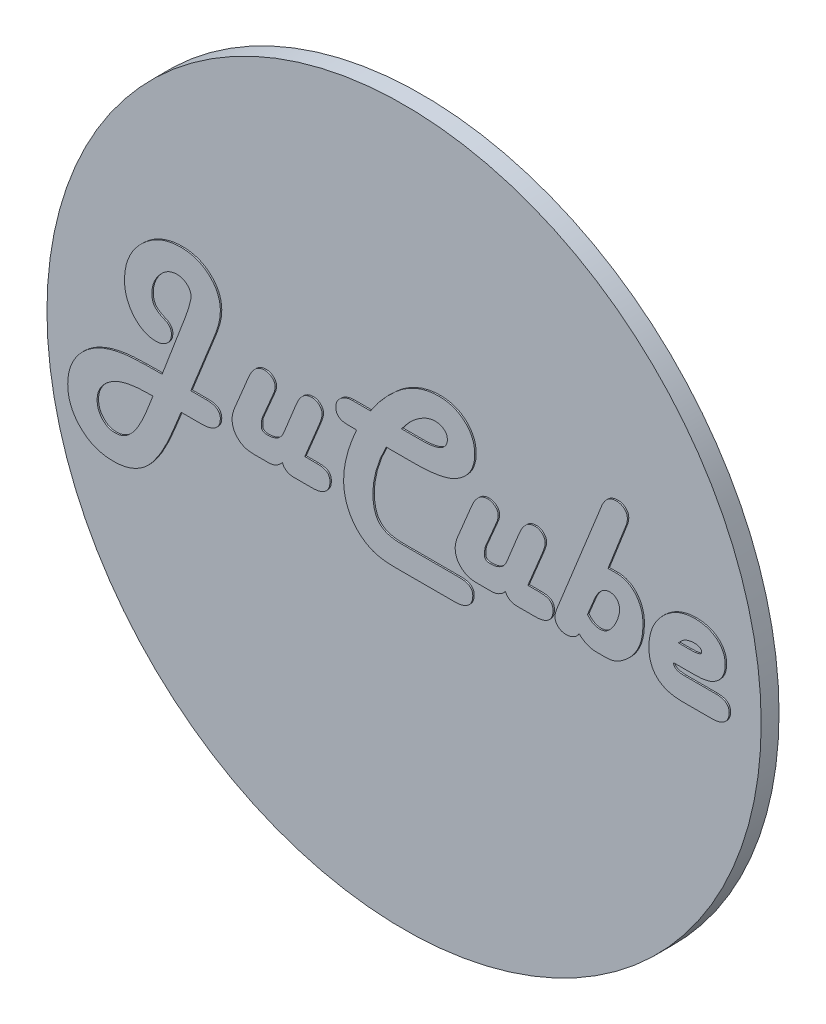
from build123d import *

# Parameters (mm, degrees)
SKETCH2_R           = 63.5
BOSS_EXTRUDE1_DEPTH = 3.175
BOSS_EXTRUDE2_DEPTH = 0.254


with BuildPart() as part:
    # Sketch2 → Boss-Extrude1 (new body)
    with BuildSketch(Plane.XY):
        Circle(SKETCH2_R)
    extrude(amount=BOSS_EXTRUDE1_DEPTH)

    # Sketch3 → Boss-Extrude2 (add)
    # profile 1 of 6: a face of its own
    with BuildSketch(Plane.XY.offset(3.175)):
        with BuildLine():
            Line((-37.659123821, 0.761566628), (-34.929928615, 0.761566628))
            add(Edge.make_bspline(
                [(-34.929928615, 0.761566628), (-34.732000697, 0.757334956), (-34.361404649, 0.749411664), (-33.846895815, 0.666966717), (-33.405729695, 0.542819083), (-33.046187459, 0.349501415), (-32.75569756, 0.108226576), (-32.55494843, -0.198645015), (-32.429839223, -0.557474704), (-32.418629851, -0.815774235), (-32.412762519, -0.950976181)],
                knots=[0, 0, 0, 0, 1.374766829, 2.57408433, 3.614346374, 4.544477883, 5.393131557, 6.21082457, 7.063490371, 8, 8, 8, 8], degree=3))
            add(Edge.make_bspline(
                [(-32.412762519, -0.950976181), (-32.42185546, -1.133653216), (-32.439475455, -1.487638649), (-32.616251317, -1.98773381), (-32.906818969, -2.421872662), (-33.307274661, -2.784915129), (-33.806577268, -3.066016083), (-34.390629542, -3.273847797), (-35.063213752, -3.389069801), (-35.538399919, -3.405247137), (-35.788918341, -3.413775838)],
                knots=[0, 0, 0, 0, 0.929567561, 1.801284846, 2.668377082, 3.571806983, 4.533225673, 5.574775137, 6.721420051, 8, 8, 8, 8], degree=3))
            Line((-35.788918341, -3.413775838), (-39.38797656, -3.413775838))
            Line((-39.38797656, -3.413775838), (-40.758010807, -6.78993166))
            add(Edge.make_bspline(
                [(-40.758010807, -6.78993166), (-40.94094851, -7.24095224), (-41.294886851, -8.113563373), (-41.869771364, -9.355300485), (-42.444799767, -10.495661457), (-43.016801144, -11.541187209), (-43.610746434, -12.474231369), (-44.203680932, -13.310722851), (-44.797157232, -14.050084639), (-45.414039488, -14.681322226), (-46.047165869, -15.232128734), (-46.718304588, -15.697839826), (-47.421880148, -16.100513336), (-48.169538921, -16.420424934), (-48.950929595, -16.677623268), (-49.772431327, -16.856998146), (-50.630135408, -16.959859916), (-51.214213211, -16.975614711), (-51.511692314, -16.983638852)],
                knots=[0, 0, 0, 0, 1.468908974, 2.841968597, 4.1287121, 5.323593136, 6.437448851, 7.465024802, 8.417576394, 9.295662056, 10.125698866, 10.94665604, 11.757436234, 12.568345582, 13.39692117, 14.237044157, 15.102101602, 16, 16, 16, 16], degree=3))
            add(Edge.make_bspline(
                [(-51.511692314, -16.983638852), (-51.79300825, -16.978714749), (-52.345174208, -16.969049735), (-53.154106481, -16.853131777), (-53.928944651, -16.683452373), (-54.668070179, -16.435918773), (-55.372159073, -16.120931999), (-56.039539903, -15.730779636), (-56.67240655, -15.273070202), (-57.261460462, -14.747471473), (-57.796234402, -14.169862414), (-58.266123003, -13.552860262), (-58.668826651, -12.903400132), (-58.986814375, -12.212637489), (-59.246634448, -11.493794487), (-59.425865919, -10.73702721), (-59.528555794, -9.946030557), (-59.544423415, -9.407067287), (-59.552488547, -9.133125153)],
                knots=[0, 0, 0, 0, 1.074409005, 2.108846326, 3.117072076, 4.102727955, 5.08240308, 6.060117382, 7.05212911, 8.062778769, 9.072478569, 10.056063612, 11.023046353, 11.986724094, 12.957247774, 13.940052078, 14.952977764, 16, 16, 16, 16], degree=3))
            add(Edge.make_bspline(
                [(-59.552488547, -9.133125153), (-59.548557226, -8.924522998), (-59.540777556, -8.511721197), (-59.47110314, -7.900011899), (-59.370206804, -7.299917087), (-59.2222682, -6.711237158), (-59.03176017, -6.133297959), (-58.797185315, -5.569163223), (-58.524541113, -5.016100147), (-58.208277655, -4.4796688), (-57.857476424, -3.957803765), (-57.463078214, -3.461419005), (-57.032657956, -2.989230409), (-56.571103829, -2.537527223), (-56.074827024, -2.110707886), (-55.539272776, -1.716170474), (-54.973299911, -1.337080429), (-54.574019145, -1.109815875), (-54.371366971, -0.994469331)],
                knots=[0, 0, 0, 0, 0.986633776, 1.952444828, 2.909577263, 3.864094578, 4.821227013, 5.786162288, 6.752467993, 7.73626618, 8.730323382, 9.725267674, 10.732877573, 11.751517376, 12.779174888, 13.826952509, 14.897084866, 16, 16, 16, 16], degree=3))
            add(Edge.make_bspline(
                [(-54.371366971, -0.994469331), (-54.098172271, -0.85535278), (-53.538982224, -0.570601315), (-52.633366723, -0.228852468), (-51.659879349, 0.074069721), (-50.607504328, 0.30607127), (-49.485249233, 0.50073947), (-48.286298376, 0.624098713), (-47.013209798, 0.709671837), (-46.138632965, 0.71881168), (-45.689046766, 0.723510121)],
                knots=[0, 0, 0, 0, 0.822641494, 1.683828184, 2.595046862, 3.558297765, 4.575076227, 5.651965759, 6.792966211, 8, 8, 8, 8], degree=3))
            Line((-45.689046766, 0.723510121), (-42.764132382, 0.761566628))
            Line((-42.764132382, 0.761566628), (-38.681212862, 11.498938203))
            add(Edge.make_bspline(
                [(-38.681212862, 11.498938203), (-38.598756739, 11.723333537), (-38.441578026, 12.151078242), (-38.230742664, 12.768315854), (-38.041899513, 13.326004628), (-37.895868336, 13.832723373), (-37.780641924, 14.282258613), (-37.697760768, 14.67557985), (-37.643957976, 15.013162142), (-37.635692743, 15.221076126), (-37.631940601, 15.315462175)],
                knots=[0, 0, 0, 0, 1.444318592, 2.753175028, 3.940779609, 5.001085105, 5.938491443, 6.743748221, 7.429703383, 8, 8, 8, 8], degree=3))
            add(Edge.make_bspline(
                [(-37.631940601, 15.315462175), (-37.639061892, 15.45638358), (-37.65322501, 15.736653912), (-37.807150594, 16.136068021), (-38.038192881, 16.508539132), (-38.362768598, 16.834041558), (-38.73995381, 17.114611654), (-39.16764032, 17.31984482), (-39.631144023, 17.443435823), (-39.95262529, 17.456352671), (-40.116486834, 17.462936491)],
                knots=[0, 0, 0, 0, 0.926502715, 1.842667016, 2.789054029, 3.8047205, 4.857979717, 5.880393009, 6.919619551, 8, 8, 8, 8], degree=3))
            add(Edge.make_bspline(
                [(-40.116486834, 17.462936491), (-40.256386136, 17.457439369), (-40.534613385, 17.44650687), (-40.946931004, 17.366410861), (-41.350246588, 17.241597811), (-41.745321775, 17.066258696), (-42.128468099, 16.835804412), (-42.495975681, 16.548195864), (-42.864391924, 16.222560887), (-43.211295225, 15.845319681), (-43.530637762, 15.438564698), (-43.820177326, 15.019493951), (-44.049500327, 14.581571233), (-44.250893892, 14.139125425), (-44.402094466, 13.681358278), (-44.510381764, 13.213674485), (-44.578911039, 12.735077402), (-44.586833199, 12.412524734), (-44.590844711, 12.249195052)],
                knots=[0, 0, 0, 0, 0.890503997, 1.771005816, 2.665315563, 3.574615816, 4.516720043, 5.504645526, 6.542601364, 7.645023422, 8.762504704, 9.834794883, 10.882965811, 11.905928596, 12.927784102, 13.946768121, 14.960313327, 16, 16, 16, 16], degree=3))
            add(Edge.make_bspline(
                [(-44.590844711, 12.249195052), (-44.58462232, 12.080249628), (-44.572677658, 11.755937689), (-44.481626816, 11.296391877), (-44.326893813, 10.890538116), (-44.112382085, 10.527047415), (-43.800760714, 10.21748581), (-43.414353194, 9.928166457), (-42.939059556, 9.657183009), (-42.582920228, 9.507038097), (-42.394440601, 9.427576901)],
                knots=[0, 0, 0, 0, 1.048922844, 2.013539002, 2.893545401, 3.737095429, 4.612700145, 5.600929284, 6.730339736, 8, 8, 8, 8], degree=3))
            add(Edge.make_bspline(
                [(-42.394440601, 9.427576901), (-42.293523138, 9.382890746), (-42.098708391, 9.296626964), (-41.835779784, 9.131728034), (-41.611140187, 8.948308597), (-41.429682502, 8.743523317), (-41.281275578, 8.523022086), (-41.186996436, 8.275294676), (-41.124177662, 8.011713598), (-41.115708098, 7.829581334), (-41.111392656, 7.736780669)],
                knots=[0, 0, 0, 0, 1.167516901, 2.25381717, 3.276011108, 4.227479954, 5.143046177, 6.073179368, 7.018239636, 8, 8, 8, 8], degree=3))
            add(Edge.make_bspline(
                [(-41.111392656, 7.736780669), (-41.120557067, 7.569052784), (-41.138563291, 7.239501236), (-41.288608462, 6.766075357), (-41.550450915, 6.345763692), (-41.88976163, 5.970131542), (-42.309936774, 5.670460098), (-42.779841794, 5.439085007), (-43.304520572, 5.308699137), (-43.669552917, 5.292941541), (-43.856897793, 5.284854299)],
                knots=[0, 0, 0, 0, 0.979783024, 1.925076521, 2.866678614, 3.857011038, 4.866165817, 5.866431161, 6.904992405, 8, 8, 8, 8], degree=3))
            add(Edge.make_bspline(
                [(-43.856897793, 5.284854299), (-44.047484016, 5.291897574), (-44.423379813, 5.305789123), (-44.976962026, 5.392893029), (-45.509000964, 5.545156757), (-46.016130847, 5.768400552), (-46.508026459, 6.037449282), (-46.97460369, 6.376016848), (-47.420093542, 6.772050462), (-47.834507718, 7.229188406), (-48.216523508, 7.722260447), (-48.554017623, 8.247919439), (-48.826828784, 8.805729123), (-49.064366477, 9.381261758), (-49.245632105, 9.985677316), (-49.366995947, 10.616134606), (-49.446193159, 11.272229654), (-49.456721611, 11.717982197), (-49.462077588, 11.944742997)],
                knots=[0, 0, 0, 0, 0.946241094, 1.866284174, 2.774639195, 3.685486034, 4.61179857, 5.553107829, 6.54086954, 7.566109643, 8.611676729, 9.635020141, 10.661049498, 11.690229817, 12.72349202, 13.78747785, 14.874457807, 16, 16, 16, 16], degree=3))
            add(Edge.make_bspline(
                [(-49.462077588, 11.944742997), (-49.452587427, 12.276911868), (-49.433830958, 12.933414513), (-49.287109542, 13.900283343), (-49.056236528, 14.836500593), (-48.718238204, 15.735098271), (-48.303231371, 16.608152048), (-47.770667662, 17.434148158), (-47.161909593, 18.239085414), (-46.460942683, 18.996553097), (-45.694871557, 19.687923497), (-44.898152047, 20.312808211), (-44.052965895, 20.819851549), (-43.186129785, 21.253809479), (-42.276946979, 21.575705222), (-41.341485028, 21.820400483), (-40.368708145, 21.955830949), (-39.710938259, 21.975991943), (-39.377103273, 21.986224162)],
                knots=[0, 0, 0, 0, 1.011155103, 1.998459391, 2.971548179, 3.942380816, 4.917345741, 5.909496761, 6.929394283, 7.987804135, 9.046559243, 10.069810793, 11.065516384, 12.042899322, 13.017020432, 13.996815416, 14.983332755, 16, 16, 16, 16], degree=3))
            add(Edge.make_bspline(
                [(-39.377103273, 21.986224162), (-39.134000327, 21.981596116), (-38.655236172, 21.972481696), (-37.954886639, 21.883117548), (-37.284303269, 21.740036106), (-36.642953579, 21.54870973), (-36.03514958, 21.28809828), (-35.457302259, 20.978697391), (-34.909394183, 20.612802278), (-34.40209964, 20.18908062), (-33.937468484, 19.725591076), (-33.526673797, 19.230483202), (-33.181447142, 18.705634418), (-32.901630164, 18.150705375), (-32.684567981, 17.566868097), (-32.525484661, 16.955227434), (-32.431984314, 16.313246959), (-32.419256223, 15.875742885), (-32.412762519, 15.652534093)],
                knots=[0, 0, 0, 0, 1.10911317, 2.184274766, 3.216023009, 4.236436679, 5.233451808, 6.228921843, 7.224529316, 8.234836295, 9.240800183, 10.216171666, 11.165921024, 12.10177449, 13.046612937, 14.003538441, 14.981431716, 16, 16, 16, 16], degree=3))
            add(Edge.make_bspline(
                [(-32.412762519, 15.652534093), (-32.425495868, 15.349140537), (-32.452302054, 14.710437853), (-32.646754358, 13.712877307), (-32.953221742, 12.630854172), (-33.229852759, 11.892116925), (-33.375048478, 11.504374847)],
                knots=[0, 0, 0, 0, 0.850166335, 1.789766162, 2.839911396, 4, 4, 4, 4], degree=3))
            Line((-33.375048478, 11.504374847), (-37.659123821, 0.761566628))
        make_face()
        with BuildLine():
            add(Edge.make_bspline(
                [(-44.395125533, -3.413775838), (-44.705074548, -3.415003178), (-45.305291902, -3.417379925), (-46.176992632, -3.460045186), (-46.993365688, -3.509813747), (-47.755469849, -3.590222225), (-48.460148251, -3.700960011), (-49.111041158, -3.822360629), (-49.705036818, -3.973094901), (-50.077095438, -4.09840074), (-50.255827588, -4.158596044)],
                knots=[0, 0, 0, 0, 1.253277197, 2.426975682, 3.528706619, 4.560583597, 5.524511111, 6.412754989, 7.237508024, 8, 8, 8, 8], degree=3))
            add(Edge.make_bspline(
                [(-50.255827588, -4.158596044), (-50.558633441, -4.27737887), (-51.14685462, -4.508122674), (-51.944648442, -4.97939686), (-52.650479214, -5.513057415), (-53.24866713, -6.120430548), (-53.730586186, -6.782596729), (-54.082514748, -7.488317528), (-54.289989603, -8.233505129), (-54.318848794, -8.742264106), (-54.333310464, -8.997209057)],
                knots=[0, 0, 0, 0, 1.156315915, 2.246223131, 3.286242349, 4.299011665, 5.269472516, 6.189856709, 7.092916461, 8, 8, 8, 8], degree=3))
            add(Edge.make_bspline(
                [(-54.333310464, -8.997209057), (-54.322141361, -9.230341707), (-54.30034302, -9.685338377), (-54.119867612, -10.338875048), (-53.827246354, -10.936765406), (-53.426355094, -11.466056406), (-52.941205018, -11.907230569), (-52.389742586, -12.229237185), (-51.783419024, -12.423088576), (-51.362687572, -12.447739515), (-51.147437177, -12.460351181)],
                knots=[0, 0, 0, 0, 1.06797539, 2.084329447, 3.084404886, 4.105236595, 5.111786419, 6.072782716, 7.01401647, 8, 8, 8, 8], degree=3))
            add(Edge.make_bspline(
                [(-51.147437177, -12.460351181), (-51.007589047, -12.456641007), (-50.729680248, -12.449268081), (-50.318942175, -12.375442306), (-49.919038893, -12.255841829), (-49.532239371, -12.084338655), (-49.15382751, -11.87164496), (-48.788243334, -11.608185192), (-48.435872758, -11.296212865), (-48.089421437, -10.939078439), (-47.751402392, -10.526900427), (-47.416216742, -10.058625109), (-47.079933018, -9.535430332), (-46.741125795, -8.958543339), (-46.411262934, -8.319787469), (-46.081682699, -7.624397943), (-45.747139206, -6.873896427), (-45.540220694, -6.34859803), (-45.433524505, -6.077731318)],
                knots=[0, 0, 0, 0, 0.738169037, 1.466903219, 2.196831274, 2.938530611, 3.6973333, 4.486394525, 5.314063054, 6.180681392, 7.112286698, 8.127279707, 9.221365764, 10.39702258, 11.660243416, 13.017718709, 14.462205991, 16, 16, 16, 16], degree=3))
            Line((-45.433524505, -6.077731318), (-44.395125533, -3.413775838))
        make_face(mode=Mode.SUBTRACT)
    # profile 2 of 6: a face of its own
    with BuildSketch(Plane.XY.offset(3.175)):
        with BuildLine():
            Line((-17.402188889, 0.761566628), (-15.276461149, 0.761566628))
            add(Edge.make_bspline(
                [(-15.276461149, 0.761566628), (-15.078578303, 0.759287218), (-14.711865945, 0.755063063), (-14.210098024, 0.678471534), (-13.794956786, 0.56519082), (-13.465404173, 0.390089382), (-13.218658697, 0.149192289), (-13.044991842, -0.152789123), (-12.94229572, -0.518608252), (-12.932837387, -0.783554627), (-12.927831012, -0.923792962)],
                knots=[0, 0, 0, 0, 1.423474627, 2.637953448, 3.6454745, 4.509973129, 5.294422611, 6.095734663, 6.992056419, 8, 8, 8, 8], degree=3))
            add(Edge.make_bspline(
                [(-12.927831012, -0.923792962), (-12.935221105, -1.109987413), (-12.949435509, -1.468121329), (-13.114997405, -1.969958778), (-13.376900736, -2.408404023), (-13.742732008, -2.776765929), (-14.20278672, -3.065743584), (-14.747055486, -3.273981391), (-15.373204983, -3.388649654), (-15.816040525, -3.405127417), (-16.048464574, -3.413775838)],
                knots=[0, 0, 0, 0, 0.986942706, 1.898325388, 2.776060673, 3.682537368, 4.631717883, 5.644811449, 6.76386964, 8, 8, 8, 8], degree=3))
            Line((-16.048464574, -3.413775838), (-19.332197451, -3.413775838))
            add(Edge.make_bspline(
                [(-19.332197451, -3.413775838), (-19.455599112, -3.408919917), (-19.692771483, -3.399587057), (-20.033757818, -3.347628606), (-20.342914078, -3.250175465), (-20.616126042, -3.10638804), (-20.860154508, -2.929348914), (-21.076613243, -2.716848765), (-21.250632979, -2.454977429), (-21.340809122, -2.262481165), (-21.387248821, -2.163347756)],
                knots=[0, 0, 0, 0, 1.152361497, 2.214786302, 3.209888758, 4.163277449, 5.083675317, 6.016734849, 6.978640777, 8, 8, 8, 8], degree=3))
            add(Edge.make_bspline(
                [(-21.387248821, -2.163347756), (-21.472587497, -2.262694357), (-21.638980275, -2.456399692), (-21.911728134, -2.716719326), (-22.208081153, -2.929265375), (-22.519938645, -3.101747599), (-22.842832813, -3.249043311), (-23.185761806, -3.344901419), (-23.545665038, -3.399401489), (-23.790056511, -3.408905678), (-23.915288204, -3.413775838)],
                knots=[0, 0, 0, 0, 1.074888274, 2.095809936, 3.086807958, 4.059318953, 5.018538645, 5.993322927, 6.971733483, 8, 8, 8, 8], degree=3))
            Line((-23.915288204, -3.413775838), (-26.595553615, -3.413775838))
            add(Edge.make_bspline(
                [(-26.595553615, -3.413775838), (-26.854136996, -3.40373138), (-27.354927273, -3.384278594), (-28.068965822, -3.192492526), (-28.714734722, -2.883683873), (-29.278811693, -2.454373797), (-29.741191577, -1.928805376), (-30.082735254, -1.3267446), (-30.291503261, -0.656414877), (-30.313723352, -0.185910159), (-30.325091286, 0.054802929)],
                knots=[0, 0, 0, 0, 1.087915245, 2.106931136, 3.090844651, 4.088450258, 5.073608295, 6.02105831, 6.987561346, 8, 8, 8, 8], degree=3))
            add(Edge.make_bspline(
                [(-30.325091286, 0.054802929), (-30.320183157, 0.203868212), (-30.309861657, 0.517343551), (-30.207044792, 1.000354574), (-30.062153222, 1.52135069), (-29.92435149, 1.871767473), (-29.852103273, 2.05548786)],
                knots=[0, 0, 0, 0, 0.863914828, 1.816760999, 2.8553473, 4, 4, 4, 4], degree=3))
            Line((-29.852103273, 2.05548786), (-27.378430327, 8.019486148))
            add(Edge.make_bspline(
                [(-27.378430327, 8.019486148), (-27.291343221, 8.215130561), (-27.12495941, 8.588917962), (-26.831696188, 9.096498409), (-26.514209176, 9.530686056), (-26.167619107, 9.883164517), (-25.79916583, 10.166399162), (-25.399603916, 10.355176183), (-24.979886333, 10.48522119), (-24.688285534, 10.497705389), (-24.540502245, 10.504032381)],
                knots=[0, 0, 0, 0, 1.280028315, 2.445551341, 3.499011175, 4.487645763, 5.393702846, 6.261350057, 7.118852184, 8, 8, 8, 8], degree=3))
            add(Edge.make_bspline(
                [(-24.540502245, 10.504032381), (-24.414712081, 10.500316255), (-24.170273167, 10.493094976), (-23.822002511, 10.393072152), (-23.498034297, 10.247385068), (-23.216416608, 10.034735634), (-22.974919214, 9.787854991), (-22.795924864, 9.505764685), (-22.686661485, 9.192475462), (-22.675816478, 8.973577172), (-22.670296766, 8.862165943)],
                knots=[0, 0, 0, 0, 1.088377808, 2.114965752, 3.121466735, 4.15669776, 5.158144943, 6.10535726, 7.035696088, 8, 8, 8, 8], degree=3))
            add(Edge.make_bspline(
                [(-22.670296766, 8.862165943), (-22.673389943, 8.77312266), (-22.67988147, 8.586251078), (-22.738962214, 8.296593203), (-22.831453357, 7.987869131), (-22.915034983, 7.779662543), (-22.958438889, 7.671540943)],
                knots=[0, 0, 0, 0, 0.865948269, 1.817331053, 2.86654086, 4, 4, 4, 4], degree=3))
            Line((-22.958438889, 7.671540943), (-23.154158067, 7.209426217))
            Line((-23.154158067, 7.209426217), (-25.035236834, 2.773124847))
            Line((-25.035236834, 2.773124847), (-25.073293341, 2.245770395))
            add(Edge.make_bspline(
                [(-25.073293341, 2.245770395), (-25.081178842, 2.11169573), (-25.094707848, 1.88166635), (-25.102614863, 1.651378967), (-25.105913204, 1.555316628)],
                knots=[0, 0, 0, 0, 1.165717742, 2, 2, 2, 2], degree=3))
            add(Edge.make_bspline(
                [(-25.105913204, 1.555316628), (-25.107194276, 1.493390257), (-25.109644699, 1.374937988), (-25.064268859, 1.209238698), (-24.987670306, 1.06541288), (-24.866391769, 0.955305125), (-24.716159452, 0.867846174), (-24.534064094, 0.802716092), (-24.317305095, 0.765289511), (-24.161908737, 0.76286808), (-24.078387519, 0.761566628)],
                knots=[0, 0, 0, 0, 0.989944688, 1.893558305, 2.727461867, 3.571461481, 4.484864337, 5.506805255, 6.659977222, 8, 8, 8, 8], degree=3))
            add(Edge.make_bspline(
                [(-24.078387519, 0.761566628), (-23.902305477, 0.766534326), (-23.562602324, 0.776118169), (-23.075210855, 0.856228085), (-22.635458897, 0.99782624), (-22.242624404, 1.195851496), (-21.895415476, 1.449224083), (-21.593282578, 1.75684915), (-21.337569223, 2.122678164), (-21.212571269, 2.397475143), (-21.148036492, 2.539349162)],
                knots=[0, 0, 0, 0, 1.152998018, 2.224400943, 3.222961798, 4.167941497, 5.093941346, 6.025705995, 6.980698316, 8, 8, 8, 8], degree=3))
            Line((-21.148036492, 2.539349162), (-18.929885807, 8.014049504))
            add(Edge.make_bspline(
                [(-18.929885807, 8.014049504), (-18.84621791, 8.209482286), (-18.686532185, 8.582478697), (-18.404783727, 9.094823181), (-18.088286848, 9.526086488), (-17.751813855, 9.884488135), (-17.387631718, 10.167554912), (-16.98904609, 10.355037708), (-16.569416246, 10.485256749), (-16.27780355, 10.497717349), (-16.130014232, 10.504032381)],
                knots=[0, 0, 0, 0, 1.276554646, 2.436389105, 3.503204744, 4.481005901, 5.382319852, 6.253756509, 7.115003774, 8, 8, 8, 8], degree=3))
            add(Edge.make_bspline(
                [(-16.130014232, 10.504032381), (-16.009779936, 10.497700741), (-15.77465904, 10.485319077), (-15.434273271, 10.389013064), (-15.121946532, 10.230411583), (-14.846267094, 10.011294266), (-14.614385056, 9.755099803), (-14.43877245, 9.467192927), (-14.337414623, 9.147847423), (-14.325627056, 8.926294898), (-14.319611834, 8.813236148)],
                knots=[0, 0, 0, 0, 1.048999871, 2.051343087, 3.063635363, 4.089572167, 5.109631033, 6.067886396, 7.014038103, 8, 8, 8, 8], degree=3))
            add(Edge.make_bspline(
                [(-14.319611834, 8.813236148), (-14.325848123, 8.707739888), (-14.339985554, 8.468583853), (-14.436658831, 8.07782782), (-14.585909584, 7.612103966), (-14.71614142, 7.281168578), (-14.787163204, 7.10069334)],
                knots=[0, 0, 0, 0, 0.709652047, 1.608754381, 2.695936919, 4, 4, 4, 4], degree=3))
            Line((-14.787163204, 7.10069334), (-17.402188889, 0.761566628))
        make_face()
    # profile 3 of 6: a face of its own
    with BuildSketch(Plane.XY.offset(3.175)):
        with BuildLine():
            add(Edge.make_bspline(
                [(-2.924406355, 9.460196764), (-3.110888384, 9.086710906), (-3.476506858, 8.354450914), (-3.955560957, 7.250065392), (-4.359505456, 6.16460287), (-4.692647162, 5.101744473), (-4.949658865, 4.057524819), (-5.13678633, 3.033992717), (-5.248494977, 2.028980833), (-5.264944955, 1.365294447), (-5.273036492, 1.038835463)],
                knots=[0, 0, 0, 0, 1.135220372, 2.225724058, 3.27216563, 4.283906486, 5.253382005, 6.19501987, 7.112152981, 8, 8, 8, 8], degree=3))
            add(Edge.make_bspline(
                [(-5.273036492, 1.038835463), (-5.271136197, 0.817577207), (-5.267452508, 0.388671957), (-5.204503622, -0.228553641), (-5.114285604, -0.799539831), (-4.987251381, -1.321395079), (-4.814644625, -1.792667656), (-4.619882919, -2.221944793), (-4.368223515, -2.592898803), (-4.092388005, -2.92683126), (-3.76060235, -3.208424107), (-3.38685358, -3.452882751), (-2.959265794, -3.654447302), (-2.487515364, -3.821322226), (-1.965185908, -3.952756363), (-1.39356115, -4.040305822), (-0.772933043, -4.104437526), (-0.342184724, -4.107882224), (-0.119098136, -4.109666249)],
                knots=[0, 0, 0, 0, 1.252459074, 2.42786996, 3.509382925, 4.524948922, 5.463153721, 6.349162468, 7.186018239, 7.994189337, 8.794568284, 9.640001636, 10.516748818, 11.46461486, 12.470227408, 13.561870161, 14.737281046, 16, 16, 16, 16], degree=3))
            Line((-0.119098136, -4.109666249), (10.085482344, -4.109666249))
            add(Edge.make_bspline(
                [(10.085482344, -4.109666249), (10.27247775, -4.114438186), (10.622846194, -4.123379241), (11.112189896, -4.199732072), (11.530644038, -4.317683534), (11.875246982, -4.500226608), (12.14338358, -4.739413007), (12.341867466, -5.028728981), (12.452020157, -5.376200233), (12.465220618, -5.622098446), (12.472168988, -5.751532688)],
                knots=[0, 0, 0, 0, 1.364402225, 2.556445067, 3.607043229, 4.52467117, 5.377329535, 6.206674295, 7.056041324, 8, 8, 8, 8], degree=3))
            add(Edge.make_bspline(
                [(12.472168988, -5.751532688), (12.46252124, -5.94126782), (12.444054089, -6.304447648), (12.280079466, -6.817568915), (12.007529634, -7.26483141), (11.623475233, -7.6364588), (11.146756495, -7.935758573), (10.576621138, -8.136246746), (9.926125438, -8.262913528), (9.464554983, -8.27737804), (9.221055974, -8.285008715)],
                knots=[0, 0, 0, 0, 0.975907244, 1.868024237, 2.744304013, 3.649190112, 4.597713907, 5.623187205, 6.746125208, 8, 8, 8, 8], degree=3))
            Line((9.221055974, -8.285008715), (-1.418456012, -8.285008715))
            add(Edge.make_bspline(
                [(-1.418456012, -8.285008715), (-1.636003908, -8.283716044), (-2.060582799, -8.281193194), (-2.680391743, -8.238519379), (-3.268677726, -8.188364892), (-3.822820204, -8.108508382), (-4.341871445, -7.995206227), (-4.830753767, -7.875832175), (-5.284593739, -7.722791989), (-5.569179565, -7.600048669), (-5.707967999, -7.540188509)],
                knots=[0, 0, 0, 0, 1.190131533, 2.322728638, 3.398279404, 4.420629422, 5.383336324, 6.304493289, 7.173125649, 8, 8, 8, 8], degree=3))
            add(Edge.make_bspline(
                [(-5.707967999, -7.540188509), (-5.890673412, -7.450535051), (-6.252304324, -7.273082938), (-6.766310714, -6.959470252), (-7.252176256, -6.61120221), (-7.705902291, -6.224989468), (-8.135105783, -5.810918503), (-8.527145658, -5.355925722), (-8.890406948, -4.865933829), (-9.227302686, -4.346334253), (-9.5274127, -3.798272314), (-9.778553936, -3.224273952), (-10.008843038, -2.638266699), (-10.1757898, -2.025805205), (-10.322208765, -1.401356909), (-10.417091309, -0.7557267), (-10.479145647, -0.091391231), (-10.487816767, 0.359109644), (-10.492214574, 0.587594025)],
                knots=[0, 0, 0, 0, 0.978821428, 1.937392436, 2.893262791, 3.852309596, 4.801915283, 5.760010259, 6.738365507, 7.734854603, 8.737656672, 9.740761978, 10.748065266, 11.763749894, 12.791822966, 13.832648446, 14.900765778, 16, 16, 16, 16], degree=3))
            add(Edge.make_bspline(
                [(-10.492214574, 0.587594025), (-10.48363573, 0.904967936), (-10.46604485, 1.555741661), (-10.359011649, 2.554944788), (-10.179155014, 3.599050291), (-9.918020648, 4.685786687), (-9.599688951, 5.819696127), (-9.196937671, 6.994554692), (-8.732004153, 8.218040744), (-8.375300766, 9.039337384), (-8.192514232, 9.460196764)],
                knots=[0, 0, 0, 0, 0.825338176, 1.692352082, 2.610409369, 3.578574102, 4.597433625, 5.671882489, 6.806996102, 8, 8, 8, 8], degree=3))
            Line((-8.192514232, 9.460196764), (-9.220039916, 9.460196764))
            Line((-9.220039916, 9.460196764), (-9.698464574, 9.460196764))
            add(Edge.make_bspline(
                [(-9.698464574, 9.460196764), (-9.869109387, 9.465297169), (-10.19055539, 9.474904872), (-10.639976897, 9.548003234), (-11.023759339, 9.675490137), (-11.336962614, 9.864015828), (-11.586218951, 10.103795428), (-11.764275315, 10.401285901), (-11.868912077, 10.752737596), (-11.878813496, 11.003465046), (-11.883995396, 11.134683066)],
                knots=[0, 0, 0, 0, 1.304291175, 2.456911397, 3.46914742, 4.376890703, 5.229335235, 6.087167935, 6.998920798, 8, 8, 8, 8], degree=3))
            add(Edge.make_bspline(
                [(-11.883995396, 11.134683066), (-11.8748013, 11.304910985), (-11.856713847, 11.639798654), (-11.673665644, 12.11376547), (-11.397889385, 12.549982887), (-11.005557942, 12.92349703), (-10.545526371, 13.243597156), (-10.020867736, 13.472559664), (-9.450386702, 13.614079989), (-9.05416978, 13.628249936), (-8.850348136, 13.63553923)],
                knots=[0, 0, 0, 0, 0.93209166, 1.833694528, 2.756955055, 3.750515861, 4.789799231, 5.824869921, 6.881071041, 8, 8, 8, 8], degree=3))
            Line((-8.850348136, 13.63553923), (-8.355613547, 13.63553923))
            Line((-8.355613547, 13.63553923), (-5.697094711, 13.63553923))
            add(Edge.make_bspline(
                [(-5.697094711, 13.63553923), (-5.403785954, 14.086735299), (-4.804549838, 15.008538601), (-3.742901028, 16.316556166), (-2.559206694, 17.61571328), (-1.678706018, 18.424545825), (-1.228173478, 18.838407381)],
                knots=[0, 0, 0, 0, 0.937855809, 1.916059648, 2.933694244, 4, 4, 4, 4], degree=3))
            add(Edge.make_bspline(
                [(-1.228173478, 18.838407381), (-0.931742381, 19.090556883), (-0.350243436, 19.585190106), (0.582125021, 20.217773348), (1.520816219, 20.76863814), (2.485952892, 21.209333095), (3.464684337, 21.562353718), (4.465506533, 21.805060808), (5.481316469, 21.95844099), (6.165121646, 21.976942425), (6.5081707, 21.986224162)],
                knots=[0, 0, 0, 0, 1.092661291, 2.143437016, 3.160869329, 4.147355701, 5.120066962, 6.07960259, 7.036581562, 8, 8, 8, 8], degree=3))
            add(Edge.make_bspline(
                [(6.5081707, 21.986224162), (6.731299119, 21.980860095), (7.168009311, 21.970361465), (7.808131944, 21.892232415), (8.419238158, 21.767539548), (9.003226403, 21.595508864), (9.556943634, 21.365147327), (10.077325543, 21.080955547), (10.5730231, 20.753097645), (11.030636945, 20.374387766), (11.447977382, 19.957981222), (11.81691781, 19.509824864), (12.124967735, 19.03005179), (12.386053254, 18.52621531), (12.581968614, 17.99065202), (12.714013195, 17.426124682), (12.807206337, 16.837161128), (12.815761136, 16.433976422), (12.820114193, 16.22881834)],
                knots=[0, 0, 0, 0, 1.119470347, 2.191043674, 3.230811999, 4.246439411, 5.241169613, 6.234027478, 7.217680394, 8.219039442, 9.209311844, 10.172275427, 11.125745502, 12.0652356, 13.014663964, 13.978528858, 14.971386723, 16, 16, 16, 16], degree=3))
            add(Edge.make_bspline(
                [(12.820114193, 16.22881834), (12.810201738, 15.938074041), (12.790830777, 15.369900284), (12.623579342, 14.545458569), (12.348480229, 13.775877585), (11.97009967, 13.053644751), (11.476831636, 12.386301429), (10.867814802, 11.781800368), (10.161378506, 11.218057488), (9.627762942, 10.905197509), (9.351535426, 10.74324471)],
                knots=[0, 0, 0, 0, 1.018804761, 1.990952639, 2.935710558, 3.876656104, 4.840123917, 5.833253974, 6.878378157, 8, 8, 8, 8], degree=3))
            add(Edge.make_bspline(
                [(9.351535426, 10.74324471), (9.143158925, 10.639352619), (8.70680151, 10.421794095), (7.981477559, 10.166608911), (7.173219299, 9.944473897), (6.276793964, 9.76874021), (5.297171783, 9.626831697), (4.229873735, 9.533357736), (3.07654212, 9.472571455), (2.278546502, 9.464418865), (1.865276864, 9.460196764)],
                knots=[0, 0, 0, 0, 0.728556699, 1.525657243, 2.402672044, 3.352039263, 4.384154211, 5.50114961, 6.705883877, 8, 8, 8, 8], degree=3))
            Line((1.865276864, 9.460196764), (-2.924406355, 9.460196764))
        make_face()
        with BuildLine():
            Line((-0.189774505, 13.63553923), (3.365790563, 13.63553923))
            add(Edge.make_bspline(
                [(3.365790563, 13.63553923), (3.550651615, 13.638111212), (3.909701882, 13.643106696), (4.428793049, 13.667560396), (4.912637792, 13.719318816), (5.361823051, 13.780292631), (5.775058914, 13.869060178), (6.152741592, 13.969025972), (6.491477377, 14.096433918), (6.798812001, 14.236352841), (7.070256092, 14.396823906), (7.303593071, 14.581949577), (7.505755392, 14.778735054), (7.66654724, 15.002635631), (7.791277752, 15.243001328), (7.886179314, 15.50171057), (7.941011886, 15.780694901), (7.946223575, 15.973058409), (7.948881316, 16.071155669)],
                knots=[0, 0, 0, 0, 1.530225532, 2.972112734, 4.29893874, 5.556827136, 6.721764215, 7.795238361, 8.787123859, 9.713203311, 10.587806911, 11.388973238, 12.173826602, 12.91489056, 13.659588691, 14.409255044, 15.188787307, 16, 16, 16, 16], degree=3))
            add(Edge.make_bspline(
                [(7.948881316, 16.071155669), (7.941376162, 16.193295066), (7.926718987, 16.431826921), (7.816625985, 16.774748092), (7.616654252, 17.073052573), (7.355334154, 17.33548939), (7.032436898, 17.543099167), (6.671457086, 17.706893205), (6.263603493, 17.790790627), (5.981136756, 17.804001445), (5.834026864, 17.810881696)],
                knots=[0, 0, 0, 0, 0.957969228, 1.870863791, 2.785970899, 3.751300333, 4.757052917, 5.782222404, 6.844971886, 8, 8, 8, 8], degree=3))
            add(Edge.make_bspline(
                [(5.834026864, 17.810881696), (5.591582309, 17.796429224), (5.090711252, 17.766571572), (4.3326581, 17.53656606), (3.554596873, 17.170622559), (2.757120444, 16.6761857), (1.965322429, 16.065509616), (1.202489164, 15.34861814), (0.47683031, 14.535458788), (0.035766814, 13.940021045), (-0.189774505, 13.63553923)],
                knots=[0, 0, 0, 0, 0.767354421, 1.585292851, 2.48966922, 3.487312267, 4.551994222, 5.652958552, 6.799821728, 8, 8, 8, 8], degree=3))
        make_face(mode=Mode.SUBTRACT)
    # profile 4 of 6: a face of its own
    with BuildSketch(Plane.XY.offset(3.175)):
        with BuildLine():
            Line((22.263564536, 0.761566628), (24.389292275, 0.761566628))
            add(Edge.make_bspline(
                [(24.389292275, 0.761566628), (24.587175122, 0.759287218), (24.95388748, 0.755063063), (25.455655401, 0.678471534), (25.870796639, 0.56519082), (26.200349252, 0.390089382), (26.447094728, 0.149192289), (26.620761583, -0.152789123), (26.723457704, -0.518608252), (26.732916038, -0.783554627), (26.737922412, -0.923792962)],
                knots=[0, 0, 0, 0, 1.423474627, 2.637953448, 3.6454745, 4.509973129, 5.294422611, 6.095734663, 6.992056419, 8, 8, 8, 8], degree=3))
            add(Edge.make_bspline(
                [(26.737922412, -0.923792962), (26.730532319, -1.109987413), (26.716317916, -1.468121329), (26.55075602, -1.969958778), (26.288852689, -2.408404023), (25.923021417, -2.776765929), (25.462966705, -3.065743584), (24.918697938, -3.273981391), (24.292548441, -3.388649654), (23.849712899, -3.405127417), (23.617288851, -3.413775838)],
                knots=[0, 0, 0, 0, 0.986942706, 1.898325388, 2.776060673, 3.682537368, 4.631717883, 5.644811449, 6.76386964, 8, 8, 8, 8], degree=3))
            Line((23.617288851, -3.413775838), (20.333555974, -3.413775838))
            add(Edge.make_bspline(
                [(20.333555974, -3.413775838), (20.210154313, -3.408919917), (19.972981941, -3.399587057), (19.631995607, -3.347628606), (19.322839347, -3.250175465), (19.049627383, -3.10638804), (18.805598916, -2.929348914), (18.589140182, -2.716848765), (18.415120445, -2.454977429), (18.324944302, -2.262481165), (18.278504604, -2.163347756)],
                knots=[0, 0, 0, 0, 1.152361497, 2.214786302, 3.209888758, 4.163277449, 5.083675317, 6.016734849, 6.978640777, 8, 8, 8, 8], degree=3))
            add(Edge.make_bspline(
                [(18.278504604, -2.163347756), (18.193165928, -2.262694357), (18.026773149, -2.456399692), (17.75402529, -2.716719326), (17.457672272, -2.929265375), (17.145814779, -3.101747599), (16.822920611, -3.249043311), (16.479991619, -3.344901419), (16.120088387, -3.399401489), (15.875696914, -3.408905678), (15.750465221, -3.413775838)],
                knots=[0, 0, 0, 0, 1.074888274, 2.095809936, 3.086807958, 4.059318953, 5.018538645, 5.993322927, 6.971733483, 8, 8, 8, 8], degree=3))
            Line((15.750465221, -3.413775838), (13.07019981, -3.413775838))
            add(Edge.make_bspline(
                [(13.07019981, -3.413775838), (12.811616428, -3.40373138), (12.310826151, -3.384278594), (11.596787603, -3.192492526), (10.951018703, -2.883683873), (10.386941731, -2.454373797), (9.924561847, -1.928805376), (9.58301817, -1.3267446), (9.374250164, -0.656414877), (9.352030073, -0.185910159), (9.340662138, 0.054802929)],
                knots=[0, 0, 0, 0, 1.087915245, 2.106931136, 3.090844651, 4.088450258, 5.073608295, 6.02105831, 6.987561346, 8, 8, 8, 8], degree=3))
            add(Edge.make_bspline(
                [(9.340662138, 0.054802929), (9.345570267, 0.203868212), (9.355891768, 0.517343551), (9.458708633, 1.000354574), (9.603600203, 1.52135069), (9.741401935, 1.871767473), (9.813650152, 2.05548786)],
                knots=[0, 0, 0, 0, 0.863914828, 1.816760999, 2.8553473, 4, 4, 4, 4], degree=3))
            Line((9.813650152, 2.05548786), (12.287323097, 8.019486148))
            add(Edge.make_bspline(
                [(12.287323097, 8.019486148), (12.374410204, 8.215130561), (12.540794015, 8.588917962), (12.834057236, 9.096498409), (13.151544248, 9.530686056), (13.498134318, 9.883164517), (13.866587595, 10.166399162), (14.266149509, 10.355176183), (14.685867092, 10.48522119), (14.977467891, 10.497705389), (15.125251179, 10.504032381)],
                knots=[0, 0, 0, 0, 1.280028315, 2.445551341, 3.499011175, 4.487645763, 5.393702846, 6.261350057, 7.118852184, 8, 8, 8, 8], degree=3))
            add(Edge.make_bspline(
                [(15.125251179, 10.504032381), (15.251041344, 10.500316255), (15.495480258, 10.493094976), (15.843750913, 10.393072152), (16.167719128, 10.247385068), (16.449336817, 10.034735634), (16.69083421, 9.787854991), (16.86982856, 9.505764685), (16.979091939, 9.192475462), (16.989936947, 8.973577172), (16.995456659, 8.862165943)],
                knots=[0, 0, 0, 0, 1.088377808, 2.114965752, 3.121466735, 4.15669776, 5.158144943, 6.10535726, 7.035696088, 8, 8, 8, 8], degree=3))
            add(Edge.make_bspline(
                [(16.995456659, 8.862165943), (16.992363482, 8.77312266), (16.985871955, 8.586251078), (16.926791211, 8.296593203), (16.834300068, 7.987869131), (16.750718442, 7.779662543), (16.707314536, 7.671540943)],
                knots=[0, 0, 0, 0, 0.865948269, 1.817331053, 2.86654086, 4, 4, 4, 4], degree=3))
            Line((16.707314536, 7.671540943), (16.511595358, 7.209426217))
            Line((16.511595358, 7.209426217), (14.63051659, 2.773124847))
            Line((14.63051659, 2.773124847), (14.592460084, 2.245770395))
            add(Edge.make_bspline(
                [(14.592460084, 2.245770395), (14.584574583, 2.11169573), (14.571045577, 1.88166635), (14.563138562, 1.651378967), (14.559840221, 1.555316628)],
                knots=[0, 0, 0, 0, 1.165717742, 2, 2, 2, 2], degree=3))
            add(Edge.make_bspline(
                [(14.559840221, 1.555316628), (14.558559149, 1.493390257), (14.556108726, 1.374937988), (14.601484566, 1.209238698), (14.678083119, 1.06541288), (14.799361656, 0.955305125), (14.949593972, 0.867846174), (15.131689331, 0.802716092), (15.348448329, 0.765289511), (15.503844688, 0.76286808), (15.587365905, 0.761566628)],
                knots=[0, 0, 0, 0, 0.989944688, 1.893558305, 2.727461867, 3.571461481, 4.484864337, 5.506805255, 6.659977222, 8, 8, 8, 8], degree=3))
            add(Edge.make_bspline(
                [(15.587365905, 0.761566628), (15.763447948, 0.766534326), (16.103151101, 0.776118169), (16.59054257, 0.856228085), (17.030294527, 0.99782624), (17.423129021, 1.195851496), (17.770337948, 1.449224083), (18.072470846, 1.75684915), (18.328184202, 2.122678164), (18.453182155, 2.397475143), (18.517716933, 2.539349162)],
                knots=[0, 0, 0, 0, 1.152998018, 2.224400943, 3.222961798, 4.167941497, 5.093941346, 6.025705995, 6.980698316, 8, 8, 8, 8], degree=3))
            Line((18.517716933, 2.539349162), (20.735867618, 8.014049504))
            add(Edge.make_bspline(
                [(20.735867618, 8.014049504), (20.819535515, 8.209482286), (20.979221239, 8.582478697), (21.260969698, 9.094823181), (21.577466577, 9.526086488), (21.91393957, 9.884488135), (22.278121706, 10.167554912), (22.676707334, 10.355037708), (23.096337178, 10.485256749), (23.387949875, 10.497717349), (23.535739193, 10.504032381)],
                knots=[0, 0, 0, 0, 1.276554646, 2.436389105, 3.503204744, 4.481005901, 5.382319852, 6.253756509, 7.115003774, 8, 8, 8, 8], degree=3))
            add(Edge.make_bspline(
                [(23.535739193, 10.504032381), (23.655973488, 10.497700741), (23.891094385, 10.485319077), (24.231480154, 10.389013064), (24.543806893, 10.230411583), (24.819486331, 10.011294266), (25.051368368, 9.755099803), (25.226980975, 9.467192927), (25.328338802, 9.147847423), (25.340126369, 8.926294898), (25.34614159, 8.813236148)],
                knots=[0, 0, 0, 0, 1.048999871, 2.051343087, 3.063635363, 4.089572167, 5.109631033, 6.067886396, 7.014038103, 8, 8, 8, 8], degree=3))
            add(Edge.make_bspline(
                [(25.34614159, 8.813236148), (25.339905302, 8.707739888), (25.325767871, 8.468583853), (25.229094593, 8.07782782), (25.07984384, 7.612103966), (24.949612004, 7.281168578), (24.878590221, 7.10069334)],
                knots=[0, 0, 0, 0, 0.709652047, 1.608754381, 2.695936919, 4, 4, 4, 4], degree=3))
            Line((24.878590221, 7.10069334), (22.263564536, 0.761566628))
        make_face()
    # profile 5 of 6: a face of its own
    with BuildSketch(Plane.XY.offset(3.175)):
        with BuildLine():
            add(Edge.make_bspline(
                [(36.518444673, 10.504032381), (36.777591362, 10.504032381), (37.265077093, 10.504032381), (37.752562823, 10.504032381), (37.980901864, 10.504032381)],
                knots=[0, 0, 0, 0, 1.063197026, 2, 2, 2, 2], degree=3))
            add(Edge.make_bspline(
                [(37.980901864, 10.504032381), (38.153398063, 10.501004346), (38.492923457, 10.495044246), (38.987734818, 10.4139315), (39.460434194, 10.296116921), (39.907825488, 10.127205008), (40.329381626, 9.908316687), (40.723579562, 9.640011415), (41.089896504, 9.320500019), (41.430059351, 8.957819838), (41.739174653, 8.558047446), (42.0056511, 8.124761234), (42.236293558, 7.667533635), (42.420644315, 7.178482086), (42.568021506, 6.662367273), (42.670443223, 6.116409542), (42.730303813, 5.541720182), (42.738962608, 5.149082719), (42.743401864, 4.947782381)],
                knots=[0, 0, 0, 0, 1.006987072, 1.982059222, 2.922169431, 3.8505747, 4.769508676, 5.691853793, 6.630352026, 7.604330819, 8.593563324, 9.578079353, 10.572682784, 11.581672705, 12.627613341, 13.705607723, 14.823693646, 16, 16, 16, 16], degree=3))
            add(Edge.make_bspline(
                [(42.743401864, 4.947782381), (42.731793607, 4.561184148), (42.709107887, 3.805665105), (42.535261044, 2.703416206), (42.231410642, 1.671134003), (41.825949741, 0.69629044), (41.285242869, -0.204674673), (40.634619436, -1.043276416), (39.860036462, -1.812956812), (39.27135294, -2.257052606), (38.970371042, -2.484109742)],
                knots=[0, 0, 0, 0, 1.067622645, 2.086427644, 3.071738449, 4.033994246, 4.994621208, 5.964863958, 6.959476384, 8, 8, 8, 8], degree=3))
            add(Edge.make_bspline(
                [(38.970371042, -2.484109742), (38.753357553, -2.627451123), (38.330601438, -2.906689273), (37.639547696, -3.193472653), (36.937646272, -3.377988611), (36.461567437, -3.401891544), (36.224865905, -3.413775838)],
                knots=[0, 0, 0, 0, 1.058097439, 2.061241283, 3.03606898, 4, 4, 4, 4], degree=3))
            Line((36.224865905, -3.413775838), (34.485139878, -3.413775838))
            add(Edge.make_bspline(
                [(34.485139878, -3.413775838), (34.336303267, -3.409417552), (34.04286387, -3.400824955), (33.611893399, -3.338114182), (33.194006425, -3.244618344), (32.798975127, -3.091554498), (32.413925229, -2.916759746), (32.054381998, -2.686621281), (31.702221835, -2.42850427), (31.48917584, -2.22391363), (31.380816248, -2.119854605)],
                knots=[0, 0, 0, 0, 1.033178099, 2.036966275, 3.019868144, 3.999380408, 4.973298425, 5.951111479, 6.957892988, 8, 8, 8, 8], degree=3))
            add(Edge.make_bspline(
                [(31.380816248, -2.119854605), (31.314833551, -2.223472992), (31.186019229, -2.425761363), (30.946969719, -2.688639295), (30.686849256, -2.913414341), (30.395012554, -3.096727817), (30.078339692, -3.244184359), (29.728842462, -3.339657184), (29.356949324, -3.401259202), (29.099501142, -3.409521666), (28.966946385, -3.413775838)],
                knots=[0, 0, 0, 0, 1.023001123, 1.997147764, 2.951387581, 3.882355666, 4.863164615, 5.853594681, 6.894860183, 8, 8, 8, 8], degree=3))
            add(Edge.make_bspline(
                [(28.966946385, -3.413775838), (28.841157444, -3.407985689), (28.594623619, -3.396637572), (28.241453327, -3.292848186), (27.914394897, -3.135565406), (27.627786352, -2.91125778), (27.389778001, -2.641948159), (27.210922069, -2.338544878), (27.102291416, -2.003828292), (27.091408421, -1.770895249), (27.085867618, -1.652303236)],
                knots=[0, 0, 0, 0, 1.051509244, 2.060853627, 3.058945725, 4.076251257, 5.087420857, 6.053476462, 7.008976386, 8, 8, 8, 8], degree=3))
            add(Edge.make_bspline(
                [(27.085867618, -1.652303236), (27.088429369, -1.557726615), (27.093846257, -1.357741927), (27.162622047, -1.052167035), (27.244437369, -0.720190421), (27.333027345, -0.500616652), (27.379446385, -0.385565222)],
                knots=[0, 0, 0, 0, 0.865990083, 1.83115821, 2.863578508, 4, 4, 4, 4], degree=3))
            Line((27.379446385, -0.385565222), (27.575165563, 0.109169367))
            Line((27.575165563, 0.109169367), (35.197340221, 19.066746422))
            Line((35.197340221, 19.066746422), (35.393059399, 19.583227586))
            add(Edge.make_bspline(
                [(35.393059399, 19.583227586), (35.464766833, 19.746820393), (35.601971063, 20.059837101), (35.869605283, 20.47470756), (36.151874143, 20.835468747), (36.467393158, 21.134313979), (36.819930153, 21.358375101), (37.198241167, 21.519138285), (37.604101883, 21.620780999), (37.886064914, 21.632369987), (38.029831659, 21.638278956)],
                knots=[0, 0, 0, 0, 1.199957747, 2.295986183, 3.310952015, 4.27721638, 5.203976475, 6.105363339, 7.033966458, 8, 8, 8, 8], degree=3))
            add(Edge.make_bspline(
                [(38.029831659, 21.638278956), (38.160747122, 21.631614391), (38.416912883, 21.618573658), (38.787246029, 21.528063334), (39.118581075, 21.358410046), (39.412430223, 21.136545806), (39.654073802, 20.868689388), (39.837344697, 20.566022535), (39.942462826, 20.22975895), (39.954006473, 19.995295721), (39.959840221, 19.876806354)],
                knots=[0, 0, 0, 0, 1.0794387, 2.112166351, 3.114400023, 4.127377956, 5.132391755, 6.070193083, 7.024744294, 8, 8, 8, 8], degree=3))
            add(Edge.make_bspline(
                [(39.959840221, 19.876806354), (39.945047832, 19.671968565), (39.913201725, 19.230979196), (39.75946264, 18.815987911), (39.677134741, 18.593758408)],
                knots=[0, 0, 0, 0, 0.928991957, 2, 2, 2, 2], degree=3))
            Line((39.677134741, 18.593758408), (39.475978919, 18.077277244))
            Line((39.475978919, 18.077277244), (36.518444673, 10.504032381))
        make_face()
        with BuildLine():
            add(Edge.make_bspline(
                [(32.870456659, 1.587936491), (33.021231345, 1.410479719), (33.309533907, 1.07115723), (33.834781279, 0.693884156), (34.404842825, 0.458236912), (34.801929972, 0.428550444), (35.001621042, 0.413621422)],
                knots=[0, 0, 0, 0, 1.105492403, 2.113858097, 3.051478503, 4, 4, 4, 4], degree=3))
            add(Edge.make_bspline(
                [(35.001621042, 0.413621422), (35.141579744, 0.420515906), (35.413427776, 0.43390737), (35.804930359, 0.519537674), (36.16248481, 0.674745795), (36.370368191, 0.822932159), (36.474951522, 0.897482723)],
                knots=[0, 0, 0, 0, 1.063104611, 2.064915538, 3.026485058, 4, 4, 4, 4], degree=3))
            add(Edge.make_bspline(
                [(36.474951522, 0.897482723), (36.614920506, 1.016699088), (36.904118763, 1.263019124), (37.273873549, 1.726949291), (37.632917281, 2.25632958), (37.942998289, 2.856839888), (38.219034235, 3.473348632), (38.413451725, 4.078901572), (38.545605675, 4.650309737), (38.56074805, 5.023239237), (38.568059399, 5.203304641)],
                knots=[0, 0, 0, 0, 0.896152114, 1.851593282, 2.885193594, 4.017729713, 5.147529607, 6.180485329, 7.12146493, 8, 8, 8, 8], degree=3))
            add(Edge.make_bspline(
                [(38.568059399, 5.203304641), (38.564583233, 5.332728311), (38.557920152, 5.580806409), (38.458159924, 5.931379245), (38.31296131, 6.24765988), (38.103883309, 6.521028424), (37.848006925, 6.743299208), (37.55333844, 6.915254032), (37.214005719, 7.005242167), (36.977394646, 7.018005797), (36.85551659, 7.024580326)],
                knots=[0, 0, 0, 0, 1.103146574, 2.11450118, 3.092037758, 4.065387865, 5.032051606, 5.975958253, 6.957418727, 8, 8, 8, 8], degree=3))
            add(Edge.make_bspline(
                [(36.85551659, 7.024580326), (36.713172504, 7.018182146), (36.432247604, 7.005554941), (36.025732633, 6.875614431), (35.641482728, 6.679984594), (35.281987368, 6.398378105), (34.946017599, 6.041290686), (34.628499265, 5.607734478), (34.343063446, 5.091212011), (34.175923101, 4.715390443), (34.088264878, 4.518287518)],
                knots=[0, 0, 0, 0, 0.858189165, 1.693689649, 2.55627534, 3.454929706, 4.439295248, 5.513272862, 6.695814091, 8, 8, 8, 8], degree=3))
            Line((34.088264878, 4.518287518), (32.870456659, 1.587936491))
        make_face(mode=Mode.SUBTRACT)
    # profile 6 of 6: a face of its own
    with BuildSketch(Plane.XY.offset(3.175)):
        with BuildLine():
            add(Edge.make_bspline(
                [(48.174609056, 1.805402244), (48.180283934, 1.722722345), (48.191328087, 1.561815004), (48.296829711, 1.339009704), (48.468322634, 1.154004407), (48.704274916, 1.008677634), (49.000696475, 0.894088828), (49.360191661, 0.817738114), (49.784326235, 0.768826512), (50.088143524, 0.764104248), (50.251407001, 0.761566628)],
                knots=[0, 0, 0, 0, 0.764367135, 1.48757176, 2.238468815, 3.079136104, 4.038989023, 5.178564659, 6.483834326, 8, 8, 8, 8], degree=3))
            Line((50.251407001, 0.761566628), (55.698924125, 0.761566628))
            add(Edge.make_bspline(
                [(55.698924125, 0.761566628), (55.882341134, 0.757228321), (56.227673718, 0.749060275), (56.71007307, 0.666516923), (57.123934823, 0.541135545), (57.468854481, 0.356411338), (57.730761226, 0.10334615), (57.922086679, -0.197699091), (58.033609874, -0.555723511), (58.04628293, -0.810620181), (58.052990905, -0.945539537)],
                knots=[0, 0, 0, 0, 1.329951266, 2.503996275, 3.539647919, 4.458105728, 5.313878097, 6.153119145, 7.022427504, 8, 8, 8, 8], degree=3))
            add(Edge.make_bspline(
                [(58.052990905, -0.945539537), (58.045721797, -1.130009244), (58.031742358, -1.484768456), (57.864080028, -1.98182316), (57.605601786, -2.420670574), (57.231467844, -2.782668396), (56.76672453, -3.063575007), (56.221556767, -3.275432817), (55.591125624, -3.388279814), (55.144794723, -3.405001952), (54.910610768, -3.413775838)],
                knots=[0, 0, 0, 0, 0.976933495, 1.878770029, 2.756138518, 3.662236408, 4.614048262, 5.626718468, 6.754770387, 8, 8, 8, 8], degree=3))
            Line((54.910610768, -3.413775838), (49.718615905, -3.413775838))
            add(Edge.make_bspline(
                [(49.718615905, -3.413775838), (49.482856699, -3.409959517), (49.026687903, -3.402575346), (48.3635271, -3.335511782), (47.744840395, -3.229841633), (47.168160005, -3.076402987), (46.634118838, -2.881722174), (46.14203927, -2.644017381), (45.697360643, -2.356338667), (45.291986816, -2.032346454), (44.938854587, -1.657499671), (44.623132487, -1.250080287), (44.369967469, -0.792502528), (44.157091053, -0.300877244), (43.986775051, 0.230335415), (43.869804611, 0.802628204), (43.797361347, 1.415713517), (43.790682053, 1.83780927), (43.787237481, 2.05548786)],
                knots=[0, 0, 0, 0, 1.227108235, 2.374322919, 3.466320313, 4.491595847, 5.476620911, 6.421800553, 7.32994879, 8.228786483, 9.116312576, 10.005091494, 10.905017908, 11.830449113, 12.791227912, 13.803396435, 14.867191708, 16, 16, 16, 16], degree=3))
            add(Edge.make_bspline(
                [(43.787237481, 2.05548786), (43.794321807, 2.33857784), (43.808277503, 2.896248067), (43.925828775, 3.717684715), (44.117961629, 4.508477764), (44.375751816, 5.274763334), (44.72354305, 6.003862129), (45.137942303, 6.707580465), (45.637576618, 7.374686218), (46.197024714, 8.011504846), (46.80962762, 8.595330099), (47.464920559, 9.100473922), (48.143207284, 9.535982261), (48.852833435, 9.892580036), (49.594716847, 10.162785502), (50.362847868, 10.360003917), (51.15890129, 10.4841718), (51.700725258, 10.497360489), (51.974823097, 10.504032381)],
                knots=[0, 0, 0, 0, 1.040395912, 2.049517343, 3.043324832, 4.029374911, 5.015897555, 6.007693059, 7.027077414, 8.075019072, 9.12126503, 10.132759007, 11.112327862, 12.080685129, 13.046081227, 14.009175581, 14.992881997, 16, 16, 16, 16], degree=3))
            add(Edge.make_bspline(
                [(51.974823097, 10.504032381), (52.172430942, 10.498926687), (52.55932423, 10.48893033), (53.125444369, 10.438124213), (53.65862946, 10.336887958), (54.164410188, 10.209845175), (54.638386751, 10.033398769), (55.085256844, 9.822581421), (55.501378335, 9.5719606), (55.879865771, 9.281361227), (56.229951554, 8.970707337), (56.530477889, 8.623760932), (56.787793136, 8.254679596), (56.994274894, 7.858998281), (57.16140764, 7.442942444), (57.272512256, 6.9983532), (57.346748284, 6.530535971), (57.353609563, 6.209382978), (57.357100495, 6.045984436)],
                knots=[0, 0, 0, 0, 1.207786243, 2.364705663, 3.468027547, 4.520851029, 5.547315103, 6.552779455, 7.536484472, 8.5087175, 9.46512013, 10.391169545, 11.306498199, 12.207991695, 13.112743612, 14.039322501, 15.002432327, 16, 16, 16, 16], degree=3))
            add(Edge.make_bspline(
                [(57.357100495, 6.045984436), (57.351055969, 5.851671527), (57.339225053, 5.471343945), (57.240531636, 4.92067522), (57.076701241, 4.41094601), (56.851182182, 3.938615952), (56.554481937, 3.507236418), (56.193073146, 3.115194843), (55.768654907, 2.75938286), (55.446416676, 2.56755846), (55.280302549, 2.468672792)],
                knots=[0, 0, 0, 0, 1.069179242, 2.092698623, 3.067607365, 4.009120459, 4.963808814, 5.93825802, 6.937169971, 8, 8, 8, 8], degree=3))
            add(Edge.make_bspline(
                [(55.280302549, 2.468672792), (55.180058652, 2.413414978), (54.972651205, 2.299085005), (54.625866072, 2.175471266), (54.249832196, 2.05741611), (53.835973168, 1.969940478), (53.388925044, 1.889312545), (52.905069777, 1.84651512), (52.386736555, 1.810390787), (52.029268248, 1.807103049), (51.844343645, 1.805402244)],
                knots=[0, 0, 0, 0, 0.775768942, 1.605087792, 2.492325041, 3.450334938, 4.473645932, 5.574054255, 6.745015868, 8, 8, 8, 8], degree=3))
            Line((51.844343645, 1.805402244), (48.174609056, 1.805402244))
        make_face()
        with BuildLine():
            Line((49.055345358, 5.284854299), (51.077776864, 5.284854299))
            add(Edge.make_bspline(
                [(51.077776864, 5.284854299), (51.246401274, 5.286383057), (51.560452705, 5.289230264), (51.997561031, 5.3236464), (52.365661329, 5.367121194), (52.665687435, 5.436160705), (52.89912783, 5.526434833), (53.06973043, 5.635581426), (53.174387735, 5.779684), (53.179317376, 5.885073482), (53.181758029, 5.937251559)],
                knots=[0, 0, 0, 0, 1.705094431, 3.175621766, 4.432939085, 5.451044315, 6.281582412, 6.952824954, 7.481546181, 8, 8, 8, 8], degree=3))
            add(Edge.make_bspline(
                [(53.181758029, 5.937251559), (53.173764331, 5.995886379), (53.158191123, 6.110117913), (53.086083651, 6.269507316), (52.965201099, 6.39506736), (52.814280669, 6.501440649), (52.625098838, 6.581265664), (52.400347092, 6.641144783), (52.136893522, 6.670927638), (51.949509155, 6.674652625), (51.849780289, 6.676635121)],
                knots=[0, 0, 0, 0, 0.838547182, 1.633645842, 2.4358048, 3.286135424, 4.243266486, 5.336598247, 6.582496278, 8, 8, 8, 8], degree=3))
            add(Edge.make_bspline(
                [(51.849780289, 6.676635121), (51.706344509, 6.672673561), (51.425179951, 6.664908064), (51.014866277, 6.597527837), (50.627025533, 6.49076254), (50.263399563, 6.334059926), (49.920134596, 6.142246864), (49.607554155, 5.894573085), (49.310582274, 5.614938608), (49.141349309, 5.396078628), (49.055345358, 5.284854299)],
                knots=[0, 0, 0, 0, 1.059074119, 2.076009944, 3.063613489, 4.023510937, 4.995010178, 5.959100355, 6.962817714, 8, 8, 8, 8], degree=3))
        make_face(mode=Mode.SUBTRACT)
    extrude(amount=BOSS_EXTRUDE2_DEPTH)


solid = part.part
